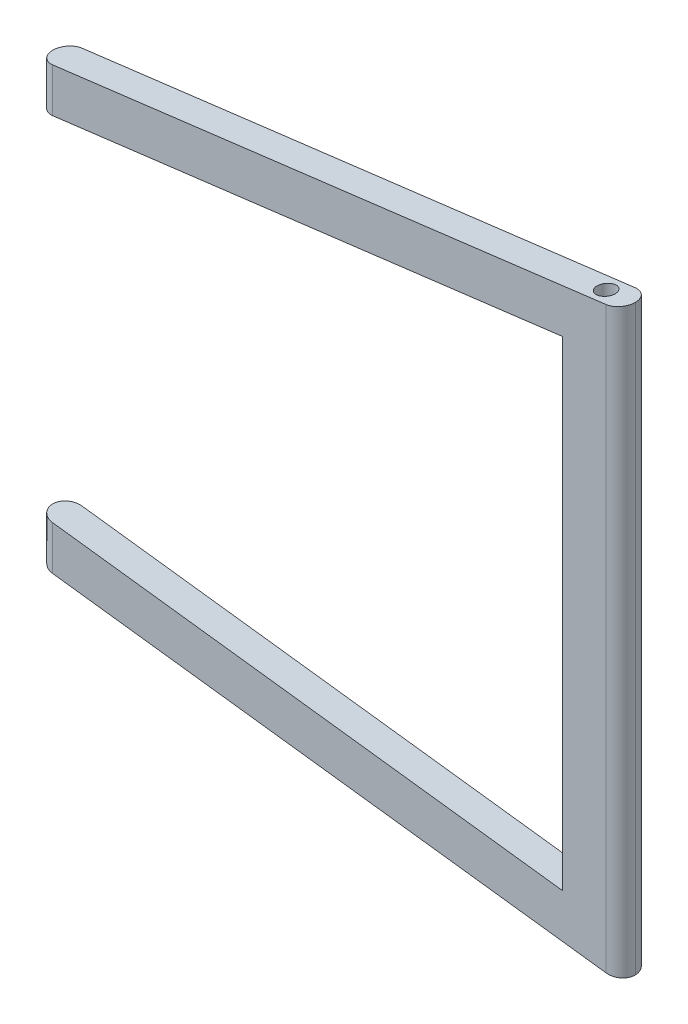
from build123d import *

# Parameters (mm, degrees)
BOSS_EXTRU_1_DEPTH      = 40
ESQUISSE2_R             = 12.5
ENL_V_MAT_EXTRU_1_DEPTH = 945.245730729
CONG_1_R                = 20
ENL_V_MAT_EXTRU_4_DEPTH = 945.245730729


with BuildPart() as part:
    # Esquisse1 → Boss.-Extru.1 (new body)
    with BuildSketch(Plane.XY):
        Polygon((500, 0), (500, 800), (-300, 700), (-300, 100), align=None)
    extrude(amount=BOSS_EXTRU_1_DEPTH)

    # Esquisse2 → Enlèv. mat.-Extru.1 (cut, through all)
    with BuildSketch(Plane(origin=(0, 0, 0), x_dir=(1, 0, 0), z_dir=(0, 1, 0))):
        with Locations((460, -20)):
            Circle(ESQUISSE2_R)
    extrude(amount=ENL_V_MAT_EXTRU_1_DEPTH, mode=Mode.SUBTRACT)

    # Congé1
    cong_1_edges = [part.edges().sort_by_distance(p)[0] for p in [
        (-300, 400, 0),
        (-300, 400, 40),
        (500, 400, 0),
        (500, 400, 40),
    ]]
    fillet(cong_1_edges, radius=CONG_1_R - 0.0001)  # a hair under: the kernel refuses the full size

    # Esquisse3 → Enlèv. mat.-Extru.4 (cut, through all)
    with BuildSketch(Plane.XY):
        Polygon((-300, 639.533066888), (-300, 160.466933112), (-292.557915925, 159.536672603), (-272.557915925, 157.036672603), (420, 70.466933112), (420, 729.533066888), (-272.557915925, 642.963327397), (-292.557915925, 640.463327397), align=None)
    extrude(amount=ENL_V_MAT_EXTRU_4_DEPTH, mode=Mode.SUBTRACT)


solid = part.part
